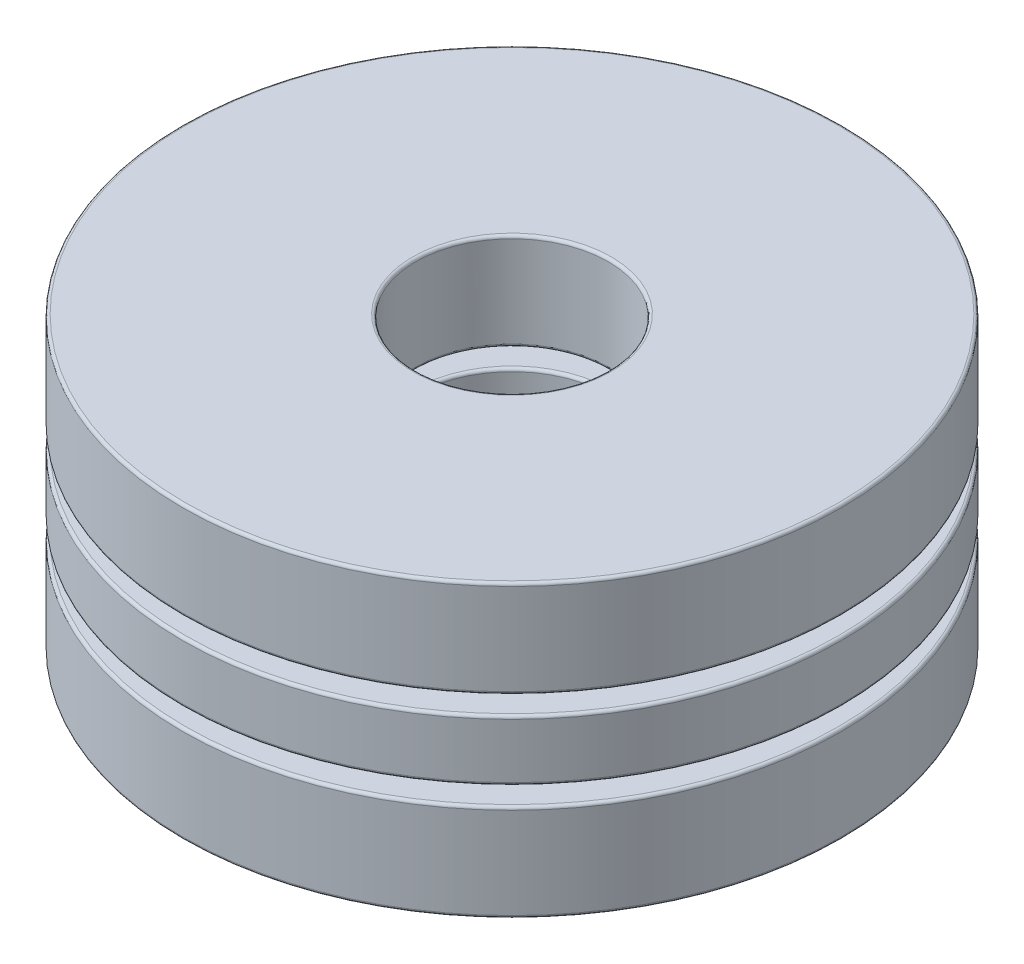
from build123d import *

# Parameters (mm, degrees)
SKETCH1_W         = 3.93065
SKETCH1_H         = 1.021291666
CIRPATTERN1_COUNT = 2
CIRPATTERN1_ANGLE = 180
CIRPATTERN2_COUNT = 2
SKETCH4_W         = 3.93065
SKETCH4_H         = 1.634066667
FILLET1_R         = 0.049022
FILLET2_R         = 0.049022
FILLET3_R         = 0.049022


with BuildPart() as part:
    # Sketch1 → Revolve1 (revolve)
    with BuildSketch(Plane(origin=(0, 0, 0), x_dir=(0, 0, -1), z_dir=(1, 0, 0))):
        with Locations((-3.590925, 0)):
            Rectangle(SKETCH1_W, SKETCH1_H)
    revolve(axis=Axis((0, -2.4511, 0), (0, 1, 0)))

    # Sketch3 → Cut-Revolve1 (revolve, cut)
    with BuildSketch(Plane(origin=(0, 0, 0), x_dir=(0, 0, -1), z_dir=(1, 0, 0))):
        with BuildLine():
            Line((-3.590925, 0.817033333), (-3.590925, -0.817033333))
            ThreePointArc((-3.590925, -0.817033333), (-4.407958333, 0), (-3.590925, 0.817033333))
        make_face()
    cut_revolve1 = revolve(axis=Axis((0, 0.817033333, 3.590925), (0, -1, 0)), mode=Mode.SUBTRACT)

    # CirPattern2: Cut-Revolve1 ×2 about axis
    cirpattern2_axis = Axis((0, 2.4511, 0), (0, -1, 0))
    for i in range(1, CIRPATTERN2_COUNT):
        add(cut_revolve1.rotate(cirpattern2_axis, i * 360 / CIRPATTERN2_COUNT), mode=Mode.SUBTRACT)

    # Fillet2
    fillet2_edges = [part.edges().sort_by_distance(p)[0] for p in [
        (0, -0.510645833, -1.6256),
        (0, 0.510645833, -1.6256),
        (0, -0.510645833, -5.55625),
        (0, 0.510645833, -5.55625),
    ]]
    fillet(fillet2_edges, radius=FILLET2_R)


with BuildPart() as body_2:
    # Sketch2 → Revolve2 (revolve)
    with BuildSketch(Plane(origin=(0, 0, 0), x_dir=(0, 0, -1), z_dir=(1, 0, 0))):
        with BuildLine():
            Line((-3.590925, 0.817033333), (-3.590925, -0.817033333))
            ThreePointArc((-3.590925, -0.817033333), (-4.407958333, 0), (-3.590925, 0.817033333))
        make_face()
    revolve(axis=Axis((0, 0.817033333, 3.590925), (0, -1, 0)))


with BuildPart() as cirpattern1_1:
    # CirPattern1: pattern copy
    add(body_2.part.rotate(Axis((0, 2.4511, 0), (0, -1, 0)), 1 * CIRPATTERN1_ANGLE / (CIRPATTERN1_COUNT - 1)))


with BuildPart() as body_4:
    # Sketch4 → Revolve3 (revolve)
    with BuildSketch(Plane(origin=(0, 0, 0), x_dir=(0, 0, -1), z_dir=(1, 0, 0))):
        with Locations((-3.590925, 1.634066667)):
            Rectangle(SKETCH4_W, SKETCH4_H)
        with Locations((-3.590925, -1.634066667)):
            Rectangle(SKETCH4_W, SKETCH4_H)
    revolve(axis=Axis((0, -2.4511, 0), (0, 1, 0)))

    # Fillet1
    fillet1_edges = [body_4.edges().sort_by_distance(p)[0] for p in [
        (0, 0.817033333, -1.6256),
        (0, 2.4511, -1.6256),
        (0, 0.817033333, -5.55625),
        (0, 2.4511, -5.55625),
    ]]
    fillet(fillet1_edges, radius=FILLET1_R)

    # Fillet3
    fillet3_edges = [body_4.edges().sort_by_distance(p)[0] for p in [
        (0, -2.4511, -1.6256),
        (0, -0.817033333, -1.6256),
        (0, -2.4511, -5.55625),
        (0, -0.817033333, -5.55625),
    ]]
    fillet(fillet3_edges, radius=FILLET3_R)


solid = Compound([part.part, body_2.part, cirpattern1_1.part, body_4.part])
